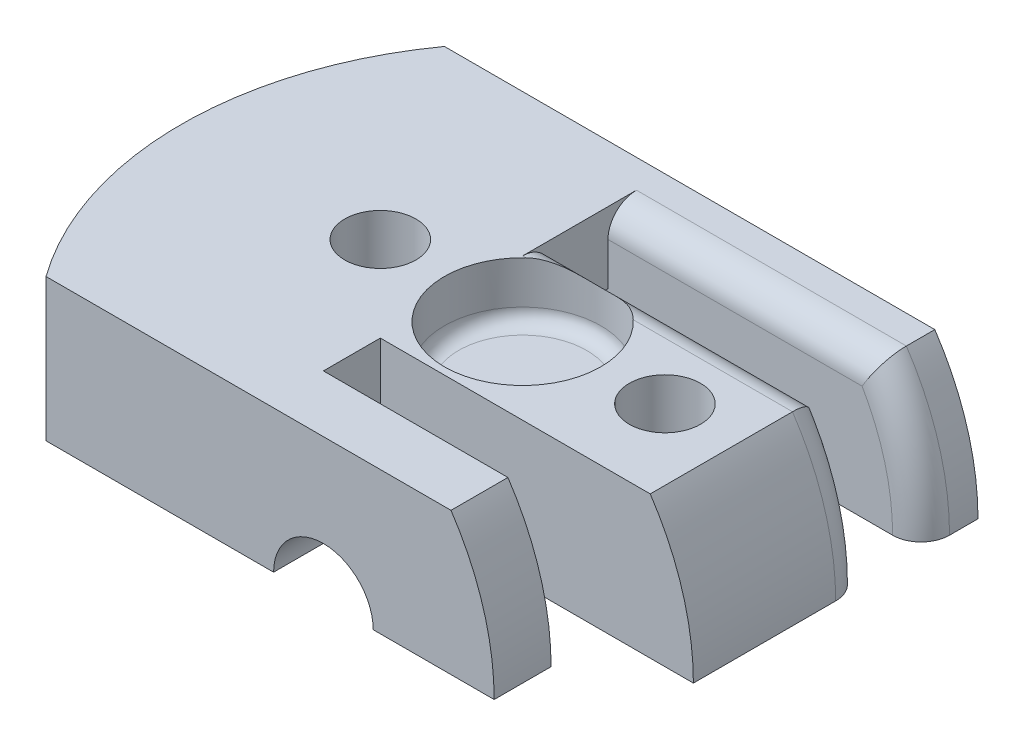
from build123d import *

# Parameters (mm, degrees)
BOSS_EXTRUDE1_DEPTH = 10
CUT_EXTRUDE3_DEPTH  = 28.676705006
CUT_EXTRUDE6_START  = -13
CUT_EXTRUDE6_DEPTH  = 2
CUT_EXTRUDE14_START = -3
CUT_EXTRUDE14_DEPTH = 2
CUT_EXTRUDE7_START  = 10
SKETCH8_R           = 2.75
CUT_EXTRUDE7_DEPTH  = 2
CUT_EXTRUDE8_START  = -16
SKETCH10_R          = 2.25
CUT_EXTRUDE8_DEPTH  = 3
CUT_EXTRUDE9_DEPTH  = 5
SKETCH18_R          = 0.75
CUT_EXTRUDE12_DEPTH = 28.676705006
CUT_EXTRUDE13_START = 5
SKETCH19_W          = 4
SKETCH19_H          = 4
CUT_EXTRUDE13_DEPTH = 1
CUT_EXTRUDE15_START = -1
SKETCH5_R           = 1.75
CUT_EXTRUDE15_DEPTH = 2
CUT_EXTRUDE16_START = -1
CUT_EXTRUDE16_DEPTH = 2
FILLET2_R           = 0.5
FILLET3_R           = 1
POT_INSERT_DEPTH    = 2.5
POT_START           = 4
SKETCH6_R           = 2.75
POT_HOLE_DEPTH      = 1.5
SCREW_START         = 11
SKETCH14_R          = 0.8
SCREW_HOLES_DEPTH   = 9
SCREW_START_2       = 10
SKETCH15_R          = 1.25
SCREW_HEADS_DEPTH   = 2
SKETCH13_W          = 21
SKETCH13_H          = 15
CUT_EXTRUDE11_DEPTH = 5


with BuildPart() as part:
    # Sketch1 → Boss-Extrude1 (new body)
    with BuildSketch(Plane(origin=(0, 0, 0), x_dir=(1, 0, 0), z_dir=(0, 1, 0))):
        with BuildLine():
            Line((21, 15), (21, 8))
            Line((21, 8), (21, 1))
            Line((21, 1), (12, 1))
            Line((12, 1), (2.253205655, 1))
            ThreePointArc((2.253205655, 1), (0, 8), (2.253205655, 15))
            Line((2.253205655, 15), (12, 15))
            Line((12, 15), (21, 15))
        make_face()
    extrude(amount=BOSS_EXTRUDE1_DEPTH)

    # Sketch4 → Cut-Extrude3 (cut, through all)
    with BuildSketch(Plane.XY):
        with BuildLine():
            Line((21, 14), (12, 14))
            ThreePointArc((12, 14), (18.363961031, 11.363961031), (21, 5))
            Line((21, 5), (21, 14))
        make_face()
        with BuildLine():
            Line((21, -4), (21, 5))
            ThreePointArc((21, 5), (18.363961031, -1.363961031), (12, -4))
            Line((12, -4), (21, -4))
        make_face()
    extrude(amount=-CUT_EXTRUDE3_DEPTH, mode=Mode.SUBTRACT)

    # Sketch7 → Cut-Extrude6 (cut)
    with BuildSketch(Plane.XY.offset(CUT_EXTRUDE6_START)):
        Polygon((21, 5.5), (21, 11), (10, 11), (10, 7.5), (0, 7.5), (0, 3.5), (21, 3.5), align=None)
    extrude(amount=CUT_EXTRUDE6_DEPTH, mode=Mode.SUBTRACT)

    # Sketch21 → Cut-Extrude14 (cut)
    with BuildSketch(Plane.XY.offset(CUT_EXTRUDE14_START)):
        Polygon((21, 5.5), (21, 11), (10, 11), (10, 7.5), (0, 7.5), (0, 3.5), (21, 3.5), align=None)
    extrude(amount=-CUT_EXTRUDE14_DEPTH, mode=Mode.SUBTRACT)

    # Sketch8 → Cut-Extrude7 (cut)
    with BuildSketch(Plane(origin=(0, 0, 0), x_dir=(1, 0, 0), z_dir=(0, 1, 0)).offset(CUT_EXTRUDE7_START)):
        with Locations(Location((12, 8, 0), (0, 0, 270))):
            Circle(SKETCH8_R)
    extrude(amount=-CUT_EXTRUDE7_DEPTH, mode=Mode.SUBTRACT)

    # Sketch10 → Cut-Extrude8 (cut)
    with BuildSketch(Plane.XY.offset(CUT_EXTRUDE8_START)):
        with Locations(Location((12, 5, 0), (0, 0, 221.810314896))):
            Circle(SKETCH10_R)
    extrude(amount=CUT_EXTRUDE8_DEPTH, mode=Mode.SUBTRACT)

    # Sketch11 → Cut-Extrude9 (cut)
    with BuildSketch(Plane(origin=(0, 0, 0), x_dir=(0, 0, -1), z_dir=(1, 0, 0))):
        Polygon((8, 2), (13, 2), (13, 8), (3, 8), (3, 2), align=None)
    extrude(amount=CUT_EXTRUDE9_DEPTH, mode=Mode.SUBTRACT)

    # Sketch18 → Cut-Extrude12 (cut, through all)
    with BuildSketch(Plane.XY):
        with Locations((12, 5)):
            Circle(SKETCH18_R)
    extrude(amount=-CUT_EXTRUDE12_DEPTH, mode=Mode.SUBTRACT)

    # Sketch19 → Cut-Extrude13 (cut, symmetric)
    with BuildSketch(Plane(origin=(0, 0, 0), x_dir=(1, 0, 0), z_dir=(0, 1, 0)).offset(CUT_EXTRUDE13_START)):
        with Locations((12, 8)):
            Rectangle(SKETCH19_W, SKETCH19_H)
    extrude(amount=CUT_EXTRUDE13_DEPTH, both=True, mode=Mode.SUBTRACT)

    # Sketch5 → Cut-Extrude15 (cut)
    with BuildSketch(Plane.XY.offset(CUT_EXTRUDE15_START)):
        with Locations((12, 5)):
            Circle(SKETCH5_R)
    extrude(amount=-CUT_EXTRUDE15_DEPTH, mode=Mode.SUBTRACT)

    # Sketch26 → Cut-Extrude16 (cut)
    with BuildSketch(Plane.XY.offset(CUT_EXTRUDE16_START)):
        with BuildLine():
            Line((16.483314774, 10), (19.483314774, 10))
            ThreePointArc((19.483314774, 10), (20.800790614, 6.883105034), (20.874119675, 3.5))
            Line((20.874119675, 3.5), (17.874119675, 3.5))
            ThreePointArc((17.874119675, 3.5), (17.800790614, 6.883105034), (16.483314774, 10))
        make_face()
    extrude(amount=-CUT_EXTRUDE16_DEPTH, mode=Mode.SUBTRACT)

    # Fillet2
    fillet2_edges = [part.edges().sort_by_distance(p)[0] for p in [
        (12, 8, -10.75),
    ]]
    fillet(fillet2_edges, radius=FILLET2_R)

    # Fillet3
    # the kernel refuses this fillet: 1 mm, written as the material it takes off along each edge
    with BuildSketch(Plane(origin=(12, 5, -13), x_dir=(0.6472427025312245, 0.7622839917118008, 0), z_dir=(-0.7622839917118008, 0.6472427025312245, 0))) as fillet3_piece_1_section:
        with BuildLine():
            CenterArc((9 - FILLET3_R, FILLET3_R), FILLET3_R, 270, 90)
            Line((9 - FILLET3_R, 0), (9, 0))
            Line((9, 0), (9, FILLET3_R))
        make_face()
    fillet3_piece_1 = revolve(axis=Axis((12, 5, -13), (0, 0, -1)), revolution_arc=75.177010416, mode=Mode.PRIVATE)
    fillet3_piece_1 = split(fillet3_piece_1, bisect_by=Plane(origin=(20.22008164, 3.5, -13.28352735), z_dir=(0, 1, 0)), keep=Keep.TOP, mode=Mode.PRIVATE)
    add(fillet3_piece_1, mode=Mode.SUBTRACT)
    with BuildSketch(Plane(origin=(12, 5, -11), x_dir=(0.9025022770828605, -0.43068508200337235, 0), z_dir=(-0.43068508200337235, -0.9025022770828605, 0))) as fillet3_piece_2_section:
        with BuildLine():
            CenterArc((9 - FILLET3_R, FILLET3_R), FILLET3_R, 270, 90)
            Line((9 - FILLET3_R, 0), (9, 0))
            Line((9, 0), (9, FILLET3_R))
        make_face()
    fillet3_piece_2 = revolve(axis=Axis((12, 5, -11), (0, 0, 1)), revolution_arc=75.177010416, mode=Mode.PRIVATE)
    fillet3_piece_2 = split(fillet3_piece_2, bisect_by=Plane(origin=(20.220081643, 3.5, -10.716472653), z_dir=(0, 1, 0)), keep=Keep.TOP, mode=Mode.PRIVATE)
    add(fillet3_piece_2, mode=Mode.SUBTRACT)
    with BuildSketch(Plane(origin=(21.983314774, 10, -11), x_dir=(0, 0, 1), z_dir=(-1, 0, 0))) as fillet3_piece_3:
        with BuildLine():
            CenterArc((FILLET3_R, -FILLET3_R), FILLET3_R, 90, 90)
            Line((0, -FILLET3_R), (0, 0))
            Line((0, 0), (FILLET3_R, 0))
        make_face()
    extrude(amount=11.983314774, mode=Mode.SUBTRACT)
    with BuildSketch(Plane(origin=(21.983314774, 10, -13), x_dir=(0, 0, -1), z_dir=(-1, 0, 0))) as fillet3_piece_4:
        with BuildLine():
            CenterArc((FILLET3_R, FILLET3_R), FILLET3_R, 180, 90)
            Line((0, FILLET3_R), (0, 0))
            Line((0, 0), (FILLET3_R, 0))
        make_face()
    extrude(amount=11.983314774, mode=Mode.SUBTRACT)

    # Sketch3 → Pot Insert (cut)
    with BuildSketch(Plane(origin=(28.28760271, 0, 0), x_dir=(1, 0, 0), z_dir=(0, 1, 0))):
        Polygon((-25.28760271, 12.5), (-20.53760271, 12.5), (-20.53760271, 13.5), (-16.28760271, 13.5), (-12.291072924, 13.5), (-12.291072924, 12.500096395), (-10.791072924, 9.500096395), (-9.28760271, 9.500096395), (-9.28760271, 8), (-9.28760271, 6.5), (-10.78760271, 6.5), (-12.28760271, 3.5), (-12.28760271, 2.5), (-16.28760271, 2.5), (-20.53760271, 2.5), (-20.53760271, 3.5), (-25.28760271, 3.5), (-25.28760271, 8), align=None)
    extrude(amount=POT_INSERT_DEPTH, mode=Mode.SUBTRACT)

    # Sketch6 → Pot Hole (cut)
    with BuildSketch(Plane(origin=(0, 0, 0), x_dir=(1, 0, 0), z_dir=(0, 1, 0)).offset(POT_START)):
        with Locations(Location((12, 8, 0), (0, 0, 270))):
            Circle(SKETCH6_R)
    extrude(amount=-POT_HOLE_DEPTH, mode=Mode.SUBTRACT)

    # Sketch14 → Screw Holes (cut)
    with BuildSketch(Plane(origin=(0, 0, 0), x_dir=(1, 0, 0), z_dir=(0, 1, 0)).offset(SCREW_START)):
        with Locations(Location((7, 8, 0), (0, 0, 270))):
            Circle(SKETCH14_R)
        with Locations(Location((17, 8, 0), (0, 0, 270))):
            Circle(SKETCH14_R)
    extrude(amount=-SCREW_HOLES_DEPTH, mode=Mode.SUBTRACT)

    # Sketch15 → Screw Heads (cut)
    with BuildSketch(Plane(origin=(0, 0, 0), x_dir=(1, 0, 0), z_dir=(0, 1, 0)).offset(SCREW_START_2)):
        with Locations(Location((7, 8, 0), (0, 0, 270))):
            Circle(SKETCH15_R)
        with Locations(Location((17, 8, 0), (0, 0, 270))):
            Circle(SKETCH15_R)
    extrude(amount=-SCREW_HEADS_DEPTH, mode=Mode.SUBTRACT)

    # Sketch13 → Cut-Extrude11 (cut)
    with BuildSketch(Plane(origin=(0, 0, 0), x_dir=(1, 0, 0), z_dir=(0, 1, 0))):
        with Locations((10.5, 7.5)):
            Rectangle(SKETCH13_W, SKETCH13_H)
    extrude(amount=CUT_EXTRUDE11_DEPTH, mode=Mode.SUBTRACT)


solid = part.part
